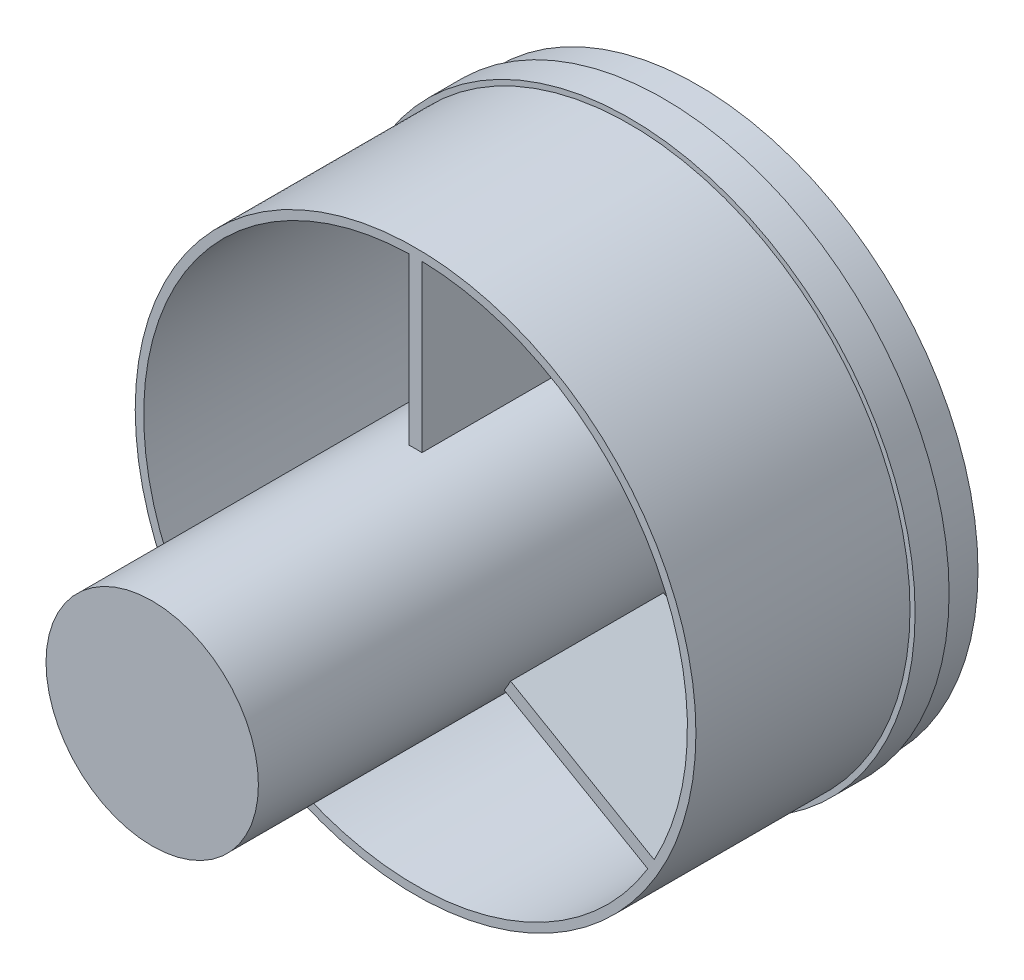
from build123d import *

# Parameters (mm, degrees)
ESQUISSE1_R             = 33
ESQUISSE1_R_2           = 32
BOSS_EXTRU_1_DEPTH      = 4
ESQUISSE2_R             = 33.6
ESQUISSE2_R_2           = 32
BOSS_EXTRU_2_DEPTH      = 4
ESQUISSE3_R             = 33
ESQUISSE3_R_2           = 32
BOSS_EXTRU_3_DEPTH      = 25.2
BOSS_EXTRU_4_DEPTH      = 12.5
BOSS_EXTRU_4_DEPTH_BACK = 64.2
ESQUISSE4_R             = 12.5
CONG_1_R                = 12.5
ESQUISSE5_W             = 1.5
ESQUISSE5_H             = 20.513996459
BOSS_EXTRU_5_DEPTH      = 18


with BuildPart() as part:
    # Esquisse1 → Boss.-Extru.1 (new body)
    with BuildSketch(Plane.XY):
        Circle(ESQUISSE1_R)
        Circle(ESQUISSE1_R_2, mode=Mode.SUBTRACT)
    extrude(amount=BOSS_EXTRU_1_DEPTH)

    # Esquisse2 → Boss.-Extru.2 (add)
    with BuildSketch(Plane.XY.offset(4)):
        Circle(ESQUISSE2_R)
        Circle(ESQUISSE2_R_2, mode=Mode.SUBTRACT)
    extrude(amount=BOSS_EXTRU_2_DEPTH)

    # Esquisse3 → Boss.-Extru.3 (add)
    with BuildSketch(Plane.XY.offset(8)):
        Circle(ESQUISSE3_R)
        Circle(ESQUISSE3_R_2, mode=Mode.SUBTRACT)
    extrude(amount=BOSS_EXTRU_3_DEPTH)



with BuildPart() as body_2:
    # Esquisse4 → Boss.-Extru.4 (new, two sides: drawn at the far end of the back side and taken through both)
    with BuildSketch(Plane(origin=(0, 0, 0), x_dir=(-1, 0, 0), z_dir=(0, 0, -1)).offset(-BOSS_EXTRU_4_DEPTH_BACK)):
        Circle(ESQUISSE4_R)
    extrude(amount=BOSS_EXTRU_4_DEPTH + BOSS_EXTRU_4_DEPTH_BACK)

    # Congé1
    cong_1_edges = [body_2.edges().sort_by_distance(p)[0] for p in [
        (12.5, 0, -12.5),
    ]]
    fillet(cong_1_edges, radius=CONG_1_R - 0.0001)  # a hair under: the kernel refuses the full size


with BuildPart() as part_1:
    add(part.part)

    add(body_2.part)  # Boss.-Extru.5 merges body 2
    # Esquisse5 → Boss.-Extru.5 (add)
    with BuildSketch(Plane.XY.offset(33.2)):
        with Locations((0, 22.734477942)):
            Rectangle(ESQUISSE5_W, ESQUISSE5_H)
        Polygon((28.196456473, -17.145257139), (10.430814407, -6.88825891), (11.180814407, -5.589220804), (28.946456473, -15.846219033), align=None)
        Polygon((-28.946456473, -15.846219033), (-11.180814407, -5.589220804), (-10.430814407, -6.88825891), (-28.196456473, -17.145257139), align=None)
    extrude(amount=-BOSS_EXTRU_5_DEPTH)


solid = part_1.part
